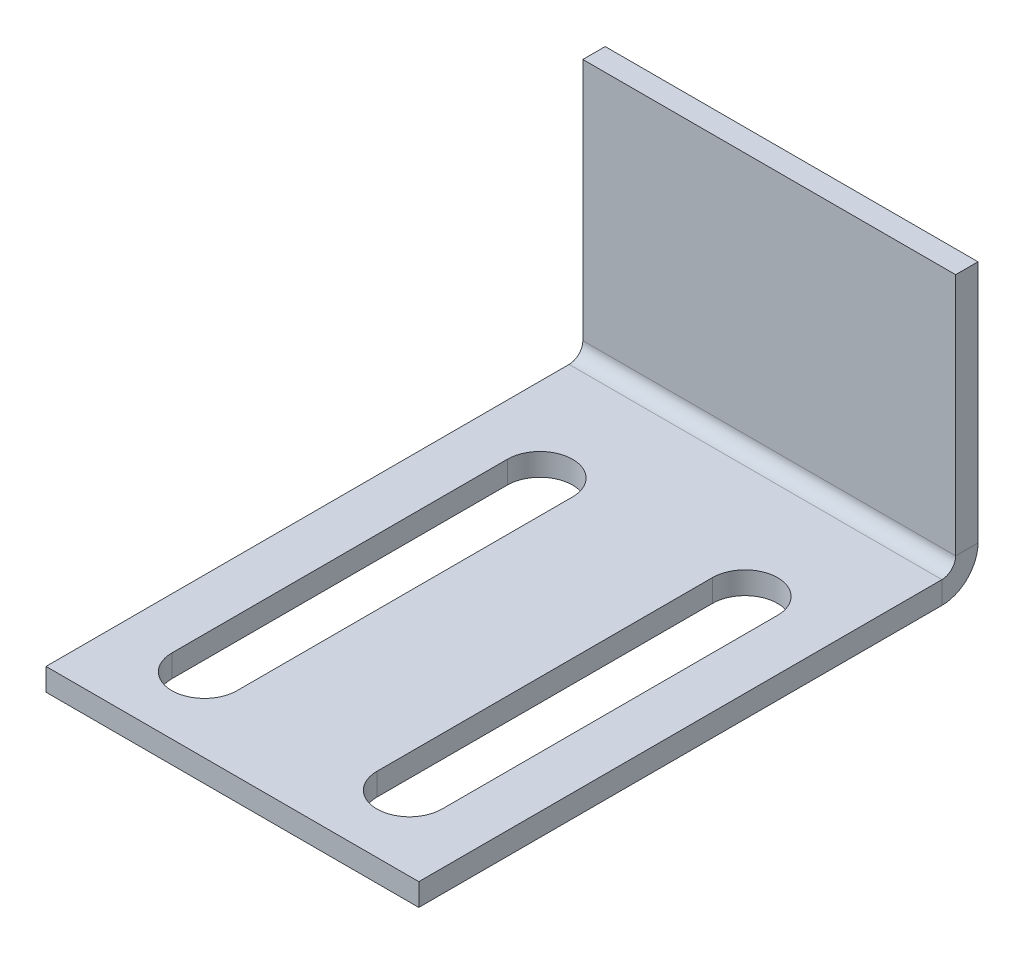
from build123d import *

# Parameters (mm, degrees)
SKETCH_1_W                       = 20
SKETCH_1_H                       = 15
SM_BASE_FLANGE_1_DEPTH           = 1.2
SM_EDGE_FLANGE_1_STRIP_W         = 6.2732
SM_EDGE_FLANGE_1_STRIP_H         = 1.2
SM_EDGE_FLANGE_1_STRIP_CUT_DEPTH = 20
SM_EDGE_FLANGE_1_DEPTH           = 20
CUT_EXTRUDE_1_REACH              = 39.681


# Sheet-metal steps are written as plain solids
with BuildPart() as part:
    # Sketch 1 → Базовая кромка1 (new body)
    with BuildSketch(Plane.XY):
        with Locations((10, 7.5)):
            Rectangle(SKETCH_1_W, SKETCH_1_H)
    extrude(amount=-SM_BASE_FLANGE_1_DEPTH)

    # Ребро-кромка1 strip (across the edge) → Ребро-кромка1 strip cut (cut)
    with BuildSketch(Plane.YZ):
        with Locations((-1.2, -0.6)):
            Rectangle(SM_EDGE_FLANGE_1_STRIP_W, SM_EDGE_FLANGE_1_STRIP_H)
    extrude(amount=SM_EDGE_FLANGE_1_STRIP_CUT_DEPTH, mode=Mode.SUBTRACT)

    # Ребро-кромка1 section (across the edge) → Ребро-кромка1 (add)
    with BuildSketch(Plane.YZ):
        with BuildLine():
            Line((0, 0.7366), (0, 28.8))
            Line((0, 28.8), (1.2, 28.8))
            Line((1.2, 28.8), (1.2, 0.7366))
            ThreePointArc((1.2, 0.7366), (1.415745145, 0.215745145), (1.9366, 0))
            Line((1.9366, 0), (1.9366, -1.2))
            ThreePointArc((1.9366, -1.2), (0.567217008, -0.632782992), (0, 0.7366))
        make_face()
    extrude(amount=SM_EDGE_FLANGE_1_DEPTH)

    # Эскиз9 → Вырез-Вытянуть1 (cut, up to next)
    with BuildSketch(Plane(origin=(0, 1.2, 0), x_dir=(1, 0, 0), z_dir=(0, 1, 0)), mode=Mode.PRIVATE) as cut_extrude_1_sk1:
        with BuildLine():
            Line((6.25, -6.8), (6.25, -24.8))
            ThreePointArc((6.25, -24.8), (4.5, -26.55), (2.75, -24.8))
            Line((2.75, -24.8), (2.75, -6.8))
            ThreePointArc((2.75, -6.8), (4.5, -5.05), (6.25, -6.8))
        make_face()
    cut_extrude_1_tool1 = extrude(cut_extrude_1_sk1.sketch, amount=-CUT_EXTRUDE_1_REACH, mode=Mode.PRIVATE) & part.part
    # Эскиз9 → Вырез-Вытянуть1 (cut, up to next)
    with BuildSketch(Plane(origin=(0, 1.2, 0), x_dir=(1, 0, 0), z_dir=(0, 1, 0)), mode=Mode.PRIVATE) as cut_extrude_1_sk2:
        with BuildLine():
            Line((17.25, -6.8), (17.25, -24.8))
            ThreePointArc((17.25, -24.8), (15.5, -26.55), (13.75, -24.8))
            Line((13.75, -24.8), (13.75, -6.8))
            ThreePointArc((13.75, -6.8), (15.5, -5.05), (17.25, -6.8))
        make_face()
    cut_extrude_1_tool2 = extrude(cut_extrude_1_sk2.sketch, amount=-CUT_EXTRUDE_1_REACH, mode=Mode.PRIVATE) & part.part
    add(cut_extrude_1_tool1.solids().sort_by_distance((4.5, 1.2, 15.8))[0], mode=Mode.SUBTRACT)
    add(cut_extrude_1_tool2.solids().sort_by_distance((15.5, 1.2, 15.8))[0], mode=Mode.SUBTRACT)


solid = part.part
